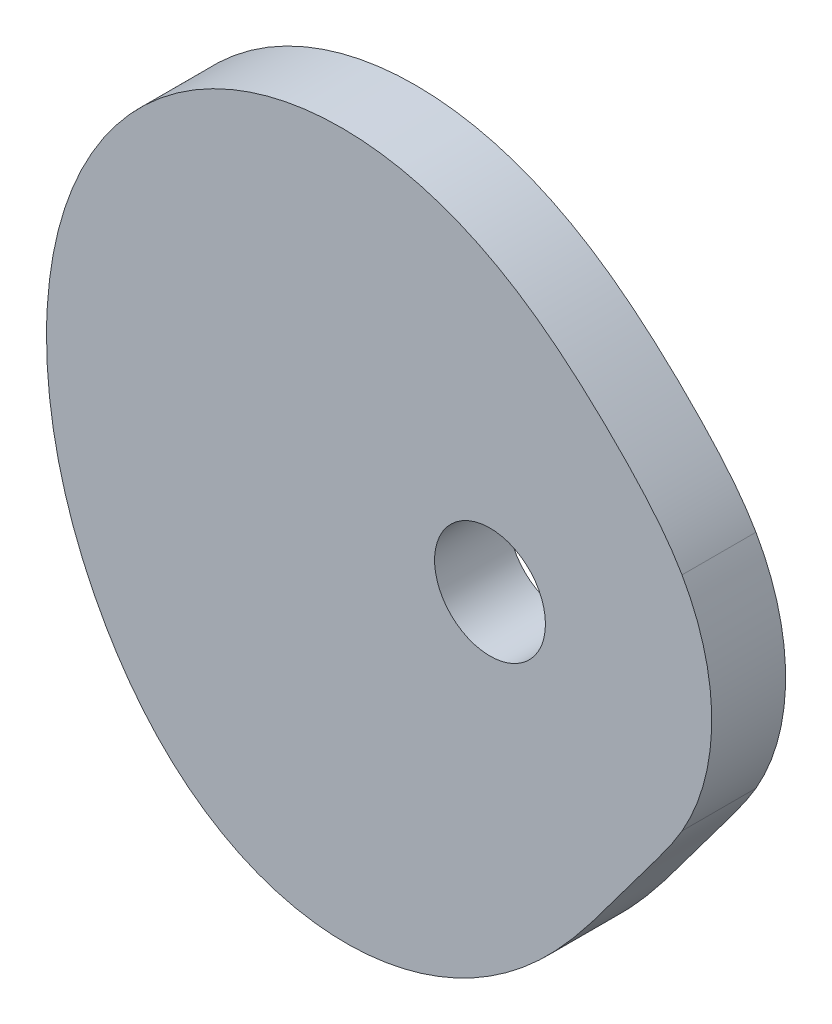
from build123d import *

# Parameters (mm, degrees)
BOSS_EXTRUDE1_DEPTH            = 5
CUT_EXTRUDE2_REACH             = 123.302
SKETCH2_R                      = 7.5
CUT_EXTRUDE2_DIRECTION_2_REACH = 123.302


with BuildPart() as part:
    # Cam Profile Sketch → Boss-Extrude1 (new, symmetric)
    with BuildSketch(Plane.XY):
        with BuildLine():
            ThreePointArc((-110, 0), (-107.955549577, -15.529142706), (-101.961524227, -30))
            add(Edge.make_bspline(
                [(-24.019237886, -15), (-24.051346201, -15.055613233), (-24.116222689, -15.166992557), (-24.266315072, -15.421104576), (-24.52170668, -15.843554665), (-24.793702544, -16.27634764), (-25.11790064, -16.775404796), (-25.45100197, -17.273214344), (-25.788940428, -17.764713141), (-26.13239749, -18.253017572), (-26.525364141, -18.801002821), (-26.968764068, -19.407760747), (-27.462972449, -20.073067804), (-28.007445516, -20.797239294), (-28.690873095, -21.700314635), (-29.512310746, -22.782996648), (-30.467113936, -24.048817574), (-31.549325281, -25.502210431), (-32.623816929, -26.961313696), (-33.695696068, -28.422323686), (-35.041457149, -30.244263798), (-36.681527673, -32.411886097), (-38.665037229, -34.887231165), (-41.07246818, -37.598818163), (-43.753070569, -40.258634067), (-46.630990899, -42.70576507), (-49.707928819, -44.899076115), (-52.973554255, -46.799689155), (-56.265761985, -48.327715824), (-59.690978427, -49.529784552), (-63.220325986, -50.380669398), (-66.819425762, -50.859717887), (-70.449372811, -50.952247367), (-74.090576876, -50.649029039), (-77.698661631, -49.942892842), (-80.784346765, -48.975121686), (-83.357819143, -47.900940501), (-85.431439618, -46.855303841), (-87.446945618, -45.701696077), (-89.379280337, -44.411234647), (-91.221315822, -42.995309829), (-92.968804876, -41.466139248), (-94.172954099, -40.310302203), (-95.200838774, -39.244966855), (-96.068223001, -38.287711927), (-96.788459947, -37.452020079), (-97.460623743, -36.632790652), (-98.087274564, -35.833410061), (-98.671442623, -35.055834112), (-99.214836695, -34.303702598), (-99.745359865, -33.54006296), (-100.260313863, -32.770469476), (-100.702543854, -32.0835302), (-101.068957853, -31.497182767), (-101.368260898, -31.006359927), (-101.621738111, -30.581911432), (-101.810438347, -30.260491053), (-101.911587727, -30.086492556), (-101.961524227, -30)],
                knots=[0.05343432, 0.05343432, 0.05343432, 0.05343432, 0.05343432, 0.05597486, 0.0585154, 0.063596479, 0.068677559, 0.073758638, 0.078839718, 0.083920798, 0.089001877, 0.094082957, 0.101794027, 0.109505097, 0.117216167, 0.124927238, 0.140349378, 0.155771518, 0.171193657, 0.186615795, 0.202037934, 0.217460072, 0.248304374, 0.279148676, 0.309992987, 0.340837298, 0.376762708, 0.407606953, 0.438451326, 0.469295709, 0.50014004, 0.530984354, 0.561828687, 0.592673032, 0.623517383, 0.655126792, 0.686736245, 0.702540962, 0.718345679, 0.734150395, 0.765759829, 0.781564547, 0.797369264, 0.813173981, 0.822562922, 0.831951864, 0.841340806, 0.850729748, 0.858632104, 0.86653446, 0.874436815, 0.882339171, 0.890241527, 0.898143883, 0.902095061, 0.906046239, 0.909997417, 0.913948595, 0.913948595, 0.913948595, 0.913948595, 0.913948595], degree=4))
            ThreePointArc((-24.019237886, -15), (-20, 0), (-24.019237886, 15))
            add(Edge.make_bspline(
                [(-24.019237886, 15), (-24.050729658, 15.054545349), (-24.11412209, 15.163389461), (-24.225067172, 15.351286176), (-24.38794809, 15.622172903), (-24.548368157, 15.883377772), (-24.704571986, 16.131984603), (-24.900163196, 16.436862169), (-25.140988366, 16.803214753), (-25.42955062, 17.22961298), (-25.84959417, 17.82921804), (-26.364611105, 18.534236991), (-26.980256436, 19.337892478), (-27.702905801, 20.235686955), (-28.439860345, 21.112663403), (-29.192976642, 21.975932442), (-29.959939053, 22.826814833), (-30.738927452, 23.666740635), (-31.528388281, 24.496791397), (-32.506697054, 25.502408093), (-33.680531445, 26.676800567), (-35.057234995, 28.012154007), (-36.647041777, 29.497052806), (-38.267741981, 30.948233988), (-39.923073266, 32.359880725), (-42.04045166, 34.066428734), (-44.665233979, 36.007022285), (-47.86099508, 38.082618239), (-51.727151001, 40.157386217), (-55.769356666, 41.866852555), (-59.961121215, 43.169913519), (-64.265451574, 44.033106869), (-68.606092376, 44.432518859), (-72.964823602, 44.357122592), (-77.288518241, 43.798018326), (-81.521867269, 42.75514859), (-85.609283511, 41.237616864), (-89.50773808, 39.258192568), (-93.164809368, 36.839856036), (-96.11061539, 34.368293838), (-98.4313968, 32.017643279), (-100.214730879, 29.923207915), (-101.54792177, 28.172403416), (-102.785144514, 26.352556873), (-104.222166124, 23.978109362), (-105.501874466, 21.485535103), (-106.499051755, 19.164199283), (-107.26568788, 17.049315782), (-107.785103438, 15.45735603), (-108.170560234, 14.137493012), (-108.515444633, 12.80645096), (-108.8203059, 11.465871074), (-109.040423873, 10.388230048), (-109.237036072, 9.306154648), (-109.410428325, 8.219942498), (-109.560905855, 7.13063236), (-109.688791655, 6.037900894), (-109.794425127, 4.94375845), (-109.878160547, 3.845917797), (-109.932589983, 2.887510104), (-109.966024595, 2.058085023), (-109.98519588, 1.382127607), (-109.995367703, 0.826574891), (-109.999160074, 0.352610993), (-110, 0.11814668), (-110, 0)],
                knots=[0.05462853, 0.05462853, 0.05462853, 0.05462853, 0.05462853, 0.056669686, 0.058710841, 0.060751996, 0.062793151, 0.064834306, 0.066875461, 0.070957771, 0.075040081, 0.079122391, 0.087287012, 0.095263226, 0.103239441, 0.111215656, 0.11919187, 0.127168085, 0.1351443, 0.143120515, 0.151096729, 0.166243215, 0.181389701, 0.196536187, 0.211682673, 0.226829188, 0.241975702, 0.27226873, 0.302561748, 0.332854766, 0.364025062, 0.394318106, 0.42461122, 0.454904337, 0.485197334, 0.515490387, 0.545783385, 0.576076455, 0.606369554, 0.637000453, 0.667631435, 0.682946914, 0.698262393, 0.713577882, 0.72889337, 0.74420885, 0.775528852, 0.791533373, 0.799191111, 0.806848848, 0.822164323, 0.82982206, 0.837479797, 0.845137535, 0.852795272, 0.860453009, 0.868110745, 0.875768482, 0.883426218, 0.891083955, 0.898741692, 0.90257056, 0.906399428, 0.910228297, 0.914057165, 0.914057165, 0.914057165, 0.914057165, 0.914057165], degree=4))
        make_face()
    extrude(amount=BOSS_EXTRUDE1_DEPTH, both=True)

    # Sketch2 → Cut-Extrude2 (cut, up to next)
    with BuildSketch(Plane.XY, mode=Mode.PRIVATE) as cut_extrude2_sk1:
        with Locations((-50, 0)):
            Circle(SKETCH2_R)
    cut_extrude2_tool1 = extrude(cut_extrude2_sk1.sketch, amount=-CUT_EXTRUDE2_REACH, mode=Mode.PRIVATE) & part.part
    add(cut_extrude2_tool1.solids().sort_by_distance((-50, 0, 0))[0], mode=Mode.SUBTRACT)

    # Sketch2 → Cut-Extrude2 direction 2 (cut, up to next)
    with BuildSketch(Plane.XY, mode=Mode.PRIVATE) as cut_extrude2_direction_2_sk1:
        with Locations((-50, 0)):
            Circle(SKETCH2_R)
    cut_extrude2_direction_2_tool1 = extrude(cut_extrude2_direction_2_sk1.sketch, amount=CUT_EXTRUDE2_DIRECTION_2_REACH, mode=Mode.PRIVATE) & part.part
    add(cut_extrude2_direction_2_tool1.solids().sort_by_distance((-50, 0, 0))[0], mode=Mode.SUBTRACT)


solid = part.part
